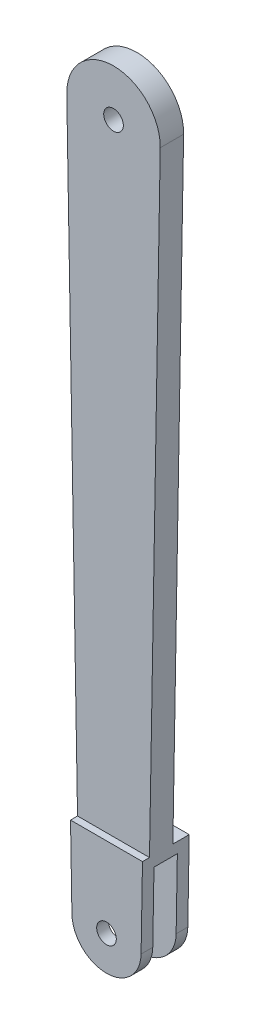
from build123d import *

# Parameters (mm, degrees)
BOSS_EXTRUDE1_DEPTH      = 2.5
SKETCH1_R                = 7.4
BOSS_EXTRUDE1_2_DEPTH    = 2.5
BOSS_EXTRUDE4_DEPTH      = 4
BOSS_EXTRUDE4_DEPTH_BACK = 10
SKETCH2_W                = 5
SKETCH2_H                = 25.381176
CUT_EXTRUDE1_DEPTH       = 20
CUT_EXTRUDE2_DEPTH       = 4
SKETCH4_R                = 2.1
CUT_EXTRUDE3_DEPTH       = 87.16844


with BuildPart() as part:
    # Sketch1 → Boss-Extrude1 (new, symmetric)
    with BuildSketch(Plane.XY):
        with BuildLine():
            Line((7.698412, -57.850642), (9.998498, 74.826667))
            ThreePointArc((9.998498, 74.826667), (0, 85), (-9.998498, 74.826667))
            Line((-9.998498, 74.826667), (-7.698412, -57.850642))
            Line((-7.698412, -57.850642), (7.698412, -57.850642))
        make_face()
    extrude(amount=BOSS_EXTRUDE1_DEPTH, both=True)



with BuildPart() as body_2:
    # Sketch1 → Boss-Extrude1 2 (new, symmetric)
    with BuildSketch(Plane.XY):
        with Locations((0, -75)):
            Circle(SKETCH1_R)
    extrude(amount=BOSS_EXTRUDE1_2_DEPTH, both=True)


with BuildPart() as part_1:
    add(part.part)

    add(body_2.part)  # Boss-Extrude4 merges body 2
    # Sketch1<6> → Boss-Extrude4 (add, two sides: drawn at the far end of the back side and taken through both)
    with BuildSketch(Plane.XY.offset(-BOSS_EXTRUDE4_DEPTH_BACK)):
        with BuildLine():
            Line((7.698412, -57.850642), (-7.698412, -57.850642))
            Line((-7.698412, -57.850642), (-7.398888, -75.128267))
            ThreePointArc((-7.398888, -75.128267), (0, -82.4), (7.398888, -75.128267))
            Line((7.398888, -75.128267), (7.698412, -57.850642))
        make_face()
    extrude(amount=BOSS_EXTRUDE4_DEPTH + BOSS_EXTRUDE4_DEPTH_BACK)

    # Sketch2 → Cut-Extrude1 (cut)
    with BuildSketch(Plane(origin=(-8.698693, -0.1508, 0), x_dir=(0, 0, 1), z_dir=(-0.9998497664927245, -0.017333333333333607, 0))):
        with Locations((-1, -72.965255)):
            Rectangle(SKETCH2_W, SKETCH2_H)
    extrude(amount=-CUT_EXTRUDE1_DEPTH, mode=Mode.SUBTRACT)

    # Sketch3 → Cut-Extrude2 (cut)
    with BuildSketch(Plane(origin=(0, 0, -10), x_dir=(-1, 0, 0), z_dir=(0, 0, -1))):
        with BuildLine():
            Line((-7.698412, -57.850642), (-7.398888, -75.128267))
            ThreePointArc((-7.398888, -75.128267), (0, -82.4), (7.398888, -75.128267))
            Line((7.398888, -75.128267), (7.698412, -57.850642))
            Line((7.698412, -57.850642), (-7.698412, -57.850642))
        make_face()
    extrude(amount=-CUT_EXTRUDE2_DEPTH, mode=Mode.SUBTRACT)

    # Sketch4 → Cut-Extrude3 (cut, through all)
    with BuildSketch(Plane.XY.offset(4)):
        with Locations((0, 75)):
            Circle(SKETCH4_R)
        with Locations((0, -75)):
            Circle(SKETCH4_R)
    extrude(amount=-CUT_EXTRUDE3_DEPTH, mode=Mode.SUBTRACT)


solid = part_1.part
